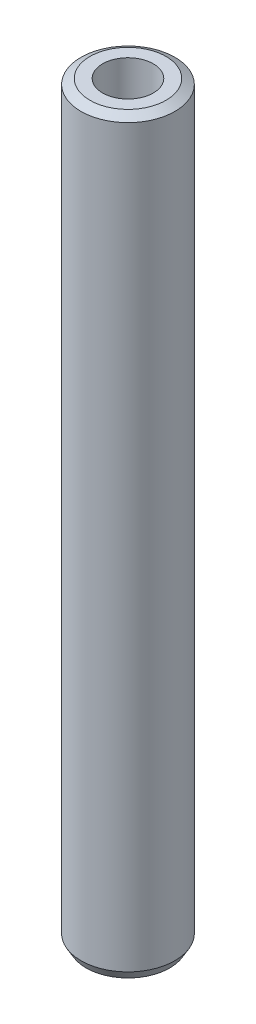
from build123d import *
from OCP.BRepFilletAPI import BRepFilletAPI_MakeChamfer

# Parameters (mm, degrees)
SKETCH1_R           = 32.5
BOSS_EXTRUDE1_DEPTH = 518.907687397
SKETCH2_R           = 17.539781922
CUT_EXTRUDE1_DEPTH  = 521.939236418
CHAMFER1_SIZE       = 3.568469639
CHAMFER1_SIZE2      = 6.18077072


with BuildPart() as part:
    # Sketch1 → Boss-Extrude1 (new body)
    with BuildSketch(Plane(origin=(0, 0, 0), x_dir=(1, 0, 0), z_dir=(0, 1, 0))):
        Circle(SKETCH1_R)
    extrude(amount=BOSS_EXTRUDE1_DEPTH)

    # Sketch2 → Cut-Extrude1 (cut, through all)
    with BuildSketch(Plane(origin=(0, 0, 0), x_dir=(1, 0, 0), z_dir=(0, 1, 0))):
        Circle(SKETCH2_R)
    extrude(amount=CUT_EXTRUDE1_DEPTH, mode=Mode.SUBTRACT)

    # Chamfer1: one chamfer whose edges measure the first distance from different faces: ONE call of the kernel's chamfer builder (chamfer() names one face for all edges)
    chamfer1_edges_1 = [part.edges().sort_by_distance(p)[0] for p in [
        (-32.5, 518.907687397, 0),
    ]]
    chamfer1_side_1 = [part.faces().sort_by_distance(p)[0] for p in [
        (-32.5, 259.453843698, 0),
    ]]
    chamfer1_edges_2 = [part.edges().sort_by_distance(p)[0] for p in [
        (-32.5, 0, 0),
    ]]
    chamfer1_side_2 = [part.faces().sort_by_distance(p)[0] for p in [
        (-31.580761184, 0, 0),
    ]]
    chamfer1 = BRepFilletAPI_MakeChamfer(part.part.solid().wrapped)
    for e in chamfer1_edges_1:
        chamfer1.Add(CHAMFER1_SIZE, CHAMFER1_SIZE2, e.wrapped, chamfer1_side_1[0].wrapped)  # the first distance lies on this face
    for e in chamfer1_edges_2:
        chamfer1.Add(CHAMFER1_SIZE, CHAMFER1_SIZE2, e.wrapped, chamfer1_side_2[0].wrapped)  # the first distance lies on this face
    add(Compound.cast(chamfer1.Shape()), mode=Mode.REPLACE)


solid = part.part
